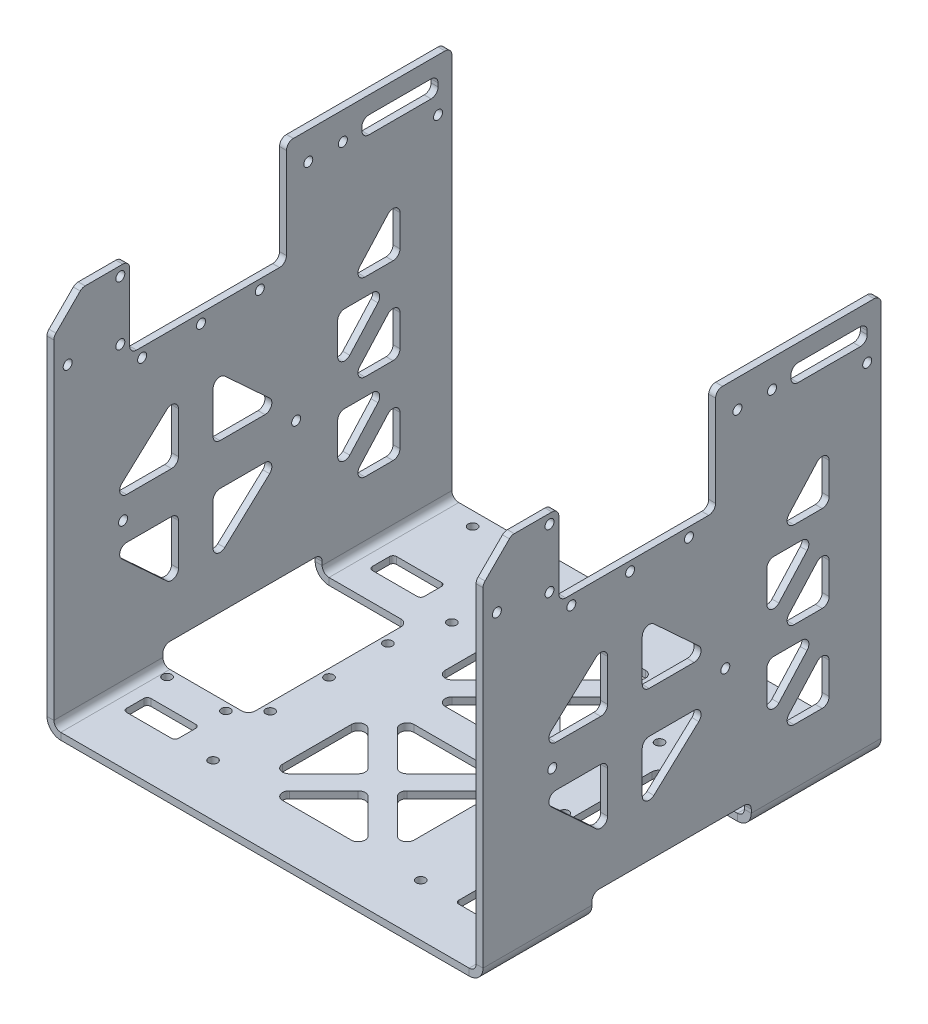
from build123d import *

# Parameters (mm, degrees)
BASE_FLANGE1_DEPTH       = 65
BASE_FLANGE1_DEPTH_BACK  = 50
CUT_EXTRUDE1_DEPTH       = 145.786049052
CUT_EXTRUDE1_DEPTH_BACK  = 145.786049052
SKETCH4_R                = 1.3
SKETCH4_R_2              = 5.623887655
CUT_EXTRUDE5_START       = -12.5
CUT_EXTRUDE5_DEPTH       = 46
CUT_EXTRUDE5_START_2     = -2
CUT_EXTRUDE5_2_OUTLINE_R = 1.3
CUT_EXTRUDE5_2_DEPTH     = 2
SKETCH26_W               = 26.75
SKETCH26_H               = 46
CUT_EXTRUDE7_DEPTH       = 7
CUT_EXTRUDE9_DEPTH       = 145.786049052
CUT_EXTRUDE9_DEPTH_BACK  = 145.786049052
SKETCH28_W               = 22
SKETCH28_H               = 5
SKETCH29_R               = 1.3
CUT_EXTRUDE10_DEPTH      = 10
CUT_EXTRUDE11_DEPTH      = 145.786049052
CUT_EXTRUDE11_DEPTH_BACK = 145.786049052
SKETCH30_R               = 1.3
CUT_EXTRUDE12_DEPTH      = 145.786049052
CUT_EXTRUDE12_DEPTH_BACK = 145.786049052
SKETCH31_R               = 1.3
CUT_EXTRUDE13_DEPTH      = 145.786049052
CUT_EXTRUDE13_DEPTH_BACK = 145.786049052
SKETCH32_R               = 1.3
SKETCH33_R               = 1.3
CUT_EXTRUDE14_DEPTH      = 5
SKETCH34_R               = 1.3
CUT_EXTRUDE15_DEPTH      = 10
CUT_EXTRUDE17_DEPTH      = 145.786049052
CUT_EXTRUDE17_DEPTH_BACK = 145.786049052
CUT_EXTRUDE18_DEPTH      = 145.786049052
CUT_EXTRUDE18_DEPTH_BACK = 145.786049052
SKETCH37_R               = 1.3
CUT_EXTRUDE19_DEPTH      = 145.786049052
CUT_EXTRUDE19_DEPTH_BACK = 145.786049052
SKETCH38_W               = 15.798506858
SKETCH38_H               = 6.8
SKETCH38_W_2             = 45.3
SKETCH38_H_2             = 30.3
FILLET1_R                = 2
CUT_EXTRUDE20_DEPTH      = 10
FILLET2_R                = 2
SKETCH40_W               = 15
SKETCH40_H               = 7
CUT_EXTRUDE21_DEPTH      = 10
FILLET4_R                = 1
CUT_EXTRUDE22_DEPTH      = 145.786049052
CUT_EXTRUDE22_DEPTH_BACK = 145.786049052
FILLET5_R                = 2
MIRROR3_START            = -63
MIRROR3_DEPTH            = 2
CUT_EXTRUDE23_DEPTH      = 145.786049052
CUT_EXTRUDE23_DEPTH_BACK = 145.786049052
FILLET6_R                = 2
MIRROR4_START            = -63
MIRROR4_DEPTH            = 2


# Read off the part's stored shape, not the designer's step: Cut-Extrude5, Mirror3, Mirror4
# Sheet-metal steps are written as plain solids
with BuildPart() as part:
    # Sketch1 → Base-Flange1 (new, two sides: drawn at the far end of the back side and taken through both)
    with BuildSketch(Plane.XY.offset(-BASE_FLANGE1_DEPTH_BACK)):
        with BuildLine():
            Line((-61, 113), (-61, 2))
            ThreePointArc((-61, 2), (-60.414213562, 0.585786438), (-59, 0))
            Line((-59, 0), (59, 0))
            ThreePointArc((59, 0), (60.414213562, 0.585786438), (61, 2))
            Line((61, 2), (61, 113))
            Line((61, 113), (63, 113))
            Line((63, 113), (63, 2))
            ThreePointArc((63, 2), (61.828427125, -0.828427125), (59, -2))
            Line((59, -2), (-59, -2))
            ThreePointArc((-59, -2), (-61.828427125, -0.828427125), (-63, 2))
            Line((-63, 2), (-63, 113))
            Line((-63, 113), (-61, 113))
        make_face()
    extrude(amount=BASE_FLANGE1_DEPTH + BASE_FLANGE1_DEPTH_BACK)

    # Sketch4 → Cut-Extrude1 (cut, two sides: drawn at the far end of the back side and taken through both)
    with BuildSketch(Plane(origin=(0, 0, 0), x_dir=(0, 0, -1), z_dir=(1, 0, 0)).offset(-CUT_EXTRUDE1_DEPTH_BACK)):
        with Locations((-22.5, 80)):
            Circle(SKETCH4_R)
        with Locations((-5.5, 80)):
            Circle(SKETCH4_R)
        with Locations((-39.5, 80)):
            Circle(SKETCH4_R)
        with Locations((-39.5, 110)):
            Circle(SKETCH4_R)
        with Locations((-22.5, 110)):
            Circle(SKETCH4_R)
        with Locations((-5.5, 110)):
            Circle(SKETCH4_R)
        with Locations((-10, 95)):
            Circle(SKETCH4_R_2)
        with Locations((-45.8, 103.5)):
            Circle(SKETCH4_R)
        with Locations((-45.8, 86.5)):
            Circle(SKETCH4_R)
    extrude(amount=CUT_EXTRUDE1_DEPTH + CUT_EXTRUDE1_DEPTH_BACK, mode=Mode.SUBTRACT)

    # Cut-Extrude5 outline → Cut-Extrude5 (cut)
    with BuildSketch(Plane.XY.offset(CUT_EXTRUDE5_START)):
        with BuildLine():
            Line((-59, -2), (-36.25, -2))
            Line((-36.25, -2), (-36.25, 0))
            Line((-36.25, 0), (-59, 0))
            ThreePointArc((-59, 0), (-59.740021111, 0.1419449), (-60.375, 0.547631245))
            Line((-60.375, 0.547631245), (-61.75, -0.90473751))
            ThreePointArc((-61.75, -0.90473751), (-60.480042223, -1.7161102), (-59, -2))
        make_face()
        with BuildLine():
            Line((36.25, 0), (36.25, -2))
            Line((36.25, -2), (59, -2))
            ThreePointArc((59, -2), (60.480042223, -1.7161102), (61.75, -0.90473751))
            Line((61.75, -0.90473751), (60.375, 0.547631245))
            ThreePointArc((60.375, 0.547631245), (59.740021111, 0.1419449), (59, 0))
            Line((59, 0), (36.25, 0))
        make_face()
    extrude(amount=CUT_EXTRUDE5_DEPTH, mode=Mode.SUBTRACT)

    # Cut-Extrude5 2 outline → Cut-Extrude5 2 (cut)
    with BuildSketch(Plane(origin=(0, 0, 0), x_dir=(1, 0, 0), z_dir=(0, 1, 0)).offset(CUT_EXTRUDE5_START_2)):
        with Locations((-57.5, -35.8)):
            Circle(CUT_EXTRUDE5_2_OUTLINE_R)
        with Locations((-40.5, -35.8)):
            Circle(CUT_EXTRUDE5_2_OUTLINE_R)
        with Locations((-34, -29.5)):
            Circle(CUT_EXTRUDE5_2_OUTLINE_R)
        with Locations((-34, -12.5)):
            Circle(CUT_EXTRUDE5_2_OUTLINE_R)
        with Locations((-34, 4.5)):
            Circle(CUT_EXTRUDE5_2_OUTLINE_R)
        with Locations((34, -12.5)):
            Circle(CUT_EXTRUDE5_2_OUTLINE_R)
        with Locations((34, 4.5)):
            Circle(CUT_EXTRUDE5_2_OUTLINE_R)
        with Locations((40.5, -35.8)):
            Circle(CUT_EXTRUDE5_2_OUTLINE_R)
        with Locations((57.5, -35.8)):
            Circle(CUT_EXTRUDE5_2_OUTLINE_R)
        with Locations((34, -29.5)):
            Circle(CUT_EXTRUDE5_2_OUTLINE_R)
    extrude(amount=CUT_EXTRUDE5_2_DEPTH, mode=Mode.SUBTRACT)

    # Sketch26 → Cut-Extrude7 (cut)
    with BuildSketch(Plane.XZ.offset(2)):
        with Locations((-49.625, 10.5)):
            Rectangle(SKETCH26_W, SKETCH26_H)
        with Locations((49.625, 10.5)):
            Rectangle(SKETCH26_W, SKETCH26_H)
    extrude(amount=-CUT_EXTRUDE7_DEPTH, mode=Mode.SUBTRACT)

    # Sketch28 → Cut-Extrude9 (cut, two sides: drawn at the far end of the back side and taken through both)
    with BuildSketch(Plane(origin=(0, 0, 0), x_dir=(0, 0, -1), z_dir=(1, 0, 0)).offset(-CUT_EXTRUDE9_DEPTH_BACK)):
        with Locations((35, 105.5)):
            Rectangle(SKETCH28_W, SKETCH28_H)
    extrude(amount=CUT_EXTRUDE9_DEPTH + CUT_EXTRUDE9_DEPTH_BACK, mode=Mode.SUBTRACT)

    # Sketch29 → Cut-Extrude10 (cut)
    with BuildSketch(Plane(origin=(0, 0, 0), x_dir=(1, 0, 0), z_dir=(0, 1, 0))):
        with Locations(Location((-31, 38, 0), (0, 0, 180))):
            Circle(SKETCH29_R)
        with Locations(Location((-31, 33, 0), (0, 0, 180))):
            Circle(SKETCH29_R)
        with Locations(Location((31, 33, 0), (0, 0, 180))):
            Circle(SKETCH29_R)
        with Locations(Location((31, 38, 0), (0, 0, 180))):
            Circle(SKETCH29_R)
    extrude(amount=-CUT_EXTRUDE10_DEPTH, mode=Mode.SUBTRACT)

    # Sketch30 → Cut-Extrude11 (cut, two sides: drawn at the far end of the back side and taken through both)
    with BuildSketch(Plane(origin=(0, 0, 0), x_dir=(0, 0, -1), z_dir=(1, 0, 0)).offset(-CUT_EXTRUDE11_DEPTH_BACK)):
        with Locations((-45, 42)):
            Circle(SKETCH30_R)
        with Locations((5, 42)):
            Circle(SKETCH30_R)
    extrude(amount=CUT_EXTRUDE11_DEPTH + CUT_EXTRUDE11_DEPTH_BACK, mode=Mode.SUBTRACT)

    # Sketch31 → Cut-Extrude12 (cut, two sides: drawn at the far end of the back side and taken through both)
    with BuildSketch(Plane(origin=(0, 0, 0), x_dir=(0, 0, -1), z_dir=(1, 0, 0)).offset(-CUT_EXTRUDE12_DEPTH_BACK)):
        with Locations((46, 98)):
            Circle(SKETCH31_R)
    extrude(amount=CUT_EXTRUDE12_DEPTH + CUT_EXTRUDE12_DEPTH_BACK, mode=Mode.SUBTRACT)

    # Sketch32 → Cut-Extrude13 (cut, two sides: drawn at the far end of the back side and taken through both)
    with BuildSketch(Plane(origin=(0, 0, 0), x_dir=(0, 0, -1), z_dir=(1, 0, 0)).offset(-CUT_EXTRUDE13_DEPTH_BACK)):
        with Locations((18.5, 105)):
            Circle(SKETCH32_R)
        with Locations((8.5, 105)):
            Circle(SKETCH32_R)
    extrude(amount=CUT_EXTRUDE13_DEPTH + CUT_EXTRUDE13_DEPTH_BACK, mode=Mode.SUBTRACT)

    # Sketch33 → Cut-Extrude14 (cut)
    with BuildSketch(Plane.XZ.offset(2)):
        with Locations((-51, -46)):
            Circle(SKETCH33_R)
        with Locations((51, -46)):
            Circle(SKETCH33_R)
    extrude(amount=-CUT_EXTRUDE14_DEPTH, mode=Mode.SUBTRACT)

    # Sketch34 → Cut-Extrude15 (cut)
    with BuildSketch(Plane(origin=(0, 0, 0), x_dir=(1, 0, 0), z_dir=(0, 1, 0))):
        with Locations(Location((-30, 19, 0), (0, 0, 180))):
            Circle(SKETCH34_R)
        with Locations(Location((30, 19, 0), (0, 0, 180))):
            Circle(SKETCH34_R)
        with Locations(Location((30, -50, 0), (0, 0, 180))):
            Circle(SKETCH34_R)
        with Locations(Location((-30, -50, 0), (0, 0, 180))):
            Circle(SKETCH34_R)
    extrude(amount=-CUT_EXTRUDE15_DEPTH, mode=Mode.SUBTRACT)

    # Sketch36 → Cut-Extrude17 (cut, two sides: drawn at the far end of the back side and taken through both)
    with BuildSketch(Plane(origin=(0, 0, 0), x_dir=(0, 0, -1), z_dir=(1, 0, 0)).offset(-CUT_EXTRUDE17_DEPTH_BACK)):
        Polygon((-65, 113), (-65, 98), (-50, 113), align=None)
    extrude(amount=CUT_EXTRUDE17_DEPTH + CUT_EXTRUDE17_DEPTH_BACK, mode=Mode.SUBTRACT)

    # Sketch37 → Cut-Extrude18 (cut, two sides: drawn at the far end of the back side and taken through both)
    with BuildSketch(Plane(origin=(0, 0, 0), x_dir=(0, 0, -1), z_dir=(1, 0, 0)).offset(-CUT_EXTRUDE18_DEPTH_BACK)):
        with Locations((-61, 89)):
            Circle(SKETCH37_R)
    extrude(amount=CUT_EXTRUDE18_DEPTH + CUT_EXTRUDE18_DEPTH_BACK, mode=Mode.SUBTRACT)

    # Sketch38 → Cut-Extrude19 (cut, two sides: drawn at the far end of the back side and taken through both)
    with BuildSketch(Plane(origin=(0, 0, 0), x_dir=(0, 0, -1), z_dir=(1, 0, 0)).offset(-CUT_EXTRUDE19_DEPTH_BACK)):
        with Locations((-50.999253429, 109.6)):
            Rectangle(SKETCH38_W, SKETCH38_H)
        with Locations((-20.45, 97.85)):
            Rectangle(SKETCH38_W_2, SKETCH38_H_2)
    extrude(amount=CUT_EXTRUDE19_DEPTH + CUT_EXTRUDE19_DEPTH_BACK, mode=Mode.SUBTRACT)

    # Fillet1
    fillet1_edges = [part.edges().sort_by_distance(p)[0] for p in [
        (-36.25, -1, 33.5),
        (-36.25, -1, -12.5),
        (36.25, -1, 33.5),
        (36.25, -1, -12.5),
        (-62, 113, -50),
        (-62, 5, -12.5),
        (-62, 5, 33.5),
        (62, 113, -50),
        (62, 5, 33.5),
        (62, 5, -12.5),
        (62, 108, -46),
        (62, 103, -46),
        (62, 103, -24),
        (62, 108, -24),
        (-62, 108, -46),
        (-62, 103, -46),
        (-62, 103, -24),
        (-62, 108, -24),
        (-62, 98, 65),
        (62, 98, 65),
        (62, 113, -2.2),
        (62, 82.7, -2.2),
        (62, 82.7, 43.1),
        (62, 106.2, 43.1),
        (62, 106.2, 56.8),
        (-62, 82.7, 43.1),
        (-62, 82.7, -2.2),
        (-62, 113, -2.2),
        (-62, 106.2, 56.8),
        (-62, 106.2, 43.1),
    ]]
    fillet(fillet1_edges, radius=FILLET1_R)

    # Sketch39 → Cut-Extrude20 (cut)
    with BuildSketch(Plane(origin=(0, 0, 0), x_dir=(1, 0, 0), z_dir=(0, 1, 0))):
        Polygon((-4.242640687, 16), (-19, 30.757359313), (-19, 1.242640687), align=None)
        Polygon((14.757359313, -3), (0, 11.757359313), (-14.757359313, -3), align=None)
        Polygon((19, 30.757359313), (4.242640687, 16), (19, 1.242640687), align=None)
        Polygon((14.757359313, 35), (-14.757359313, 35), (0, 20.242640687), align=None)
        Polygon((14.757359313, -12), (-14.757359313, -12), (0, -26.757359313), align=None)
        Polygon((-4.242640687, -31), (-19, -16.242640687), (-19, -45.757359313), align=None)
        Polygon((14.757359313, -50), (0, -35.242640687), (-14.757359313, -50), align=None)
        Polygon((19, -45.757359313), (19, -16.242640687), (4.242640687, -31), align=None)
    extrude(amount=-CUT_EXTRUDE20_DEPTH, mode=Mode.SUBTRACT)

    # Fillet2
    fillet2_edges = [part.edges().sort_by_distance(p)[0] for p in [
        (-14.757359313, -1, 12),
        (14.757359313, -1, 12),
        (0, -1, 26.757359313),
        (0, -1, -20.242640687),
        (-14.757359313, -1, -35),
        (14.757359313, -1, -35),
        (0, -1, -11.757359313),
        (14.757359313, -1, 3),
        (-14.757359313, -1, 3),
        (19, -1, -30.757359313),
        (19, -1, -1.242640687),
        (4.242640687, -1, -16),
        (4.242640687, -1, 31),
        (19, -1, 16.242640687),
        (19, -1, 45.757359313),
        (-4.242640687, -1, 31),
        (-19, -1, 45.757359313),
        (-19, -1, 16.242640687),
        (14.757359313, -1, 50),
        (-14.757359313, -1, 50),
        (0, -1, 35.242640687),
        (-19, -1, -1.242640687),
        (-19, -1, -30.757359313),
        (-4.242640687, -1, -16),
    ]]
    fillet(fillet2_edges, radius=FILLET2_R)

    # Sketch40 → Cut-Extrude21 (cut)
    with BuildSketch(Plane(origin=(0, 0, 0), x_dir=(1, 0, 0), z_dir=(0, 1, 0))):
        with Locations((-48, 24)):
            Rectangle(SKETCH40_W, SKETCH40_H)
        with Locations((-48, -47)):
            Rectangle(SKETCH40_W, SKETCH40_H)
        with Locations((48, -47)):
            Rectangle(SKETCH40_W, SKETCH40_H)
        with Locations((48, 24)):
            Rectangle(SKETCH40_W, SKETCH40_H)
    extrude(amount=-CUT_EXTRUDE21_DEPTH, mode=Mode.SUBTRACT)

    # Fillet4
    fillet4_edges = [part.edges().sort_by_distance(p)[0] for p in [
        (55.5, -1, -27.5),
        (55.5, -1, -20.5),
        (40.5, -1, -20.5),
        (40.5, -1, -27.5),
        (55.5, -1, 43.5),
        (55.5, -1, 50.5),
        (40.5, -1, 50.5),
        (40.5, -1, 43.5),
        (-40.5, -1, 43.5),
        (-40.5, -1, 50.5),
        (-55.5, -1, 50.5),
        (-55.5, -1, 43.5),
        (-40.5, -1, -27.5),
        (-40.5, -1, -20.5),
        (-55.5, -1, -20.5),
        (-55.5, -1, -27.5),
    ]]
    fillet(fillet4_edges, radius=FILLET4_R)

    # Sketch41 → Cut-Extrude22 (cut, two sides: drawn at the far end of the back side and taken through both)
    with BuildSketch(Plane(origin=(0, 0, 0), x_dir=(0, 0, -1), z_dir=(1, 0, 0)).offset(-CUT_EXTRUDE22_DEPTH_BACK)):
        Polygon((35, 68), (35, 84.262882209), (20.363406012, 68), align=None)
        Polygon((31.636593988, 63), (17, 63), (17, 46.737117791), align=None)
        Polygon((35, 43), (35, 59.262882209), (20.363406012, 43), align=None)
        Polygon((31.636593988, 38), (17, 38), (17, 21.737117791), align=None)
        Polygon((35, 18), (35, 34.262882209), (20.363406012, 18), align=None)
    extrude(amount=CUT_EXTRUDE22_DEPTH + CUT_EXTRUDE22_DEPTH_BACK, mode=Mode.SUBTRACT)

    # Fillet5
    fillet5_edges = [part.edges().sort_by_distance(p)[0] for p in [
        (62, 84.262882209, -35),
        (62, 68, -35),
        (62, 68, -20.363406012),
        (62, 59.262882209, -35),
        (62, 43, -35),
        (62, 43, -20.363406012),
        (62, 46.737117791, -17),
        (62, 63, -17),
        (62, 63, -31.636593988),
        (62, 34.262882209, -35),
        (62, 18, -35),
        (62, 18, -20.363406012),
        (62, 38, -31.636593988),
        (62, 21.737117791, -17),
        (62, 38, -17),
    ]]
    fillet(fillet5_edges, radius=FILLET5_R)

    # Mirror3 outline → Mirror3 (add)
    with BuildSketch(Plane.YZ.offset(MIRROR3_START)):
        with BuildLine():
            Line((46.737117791, -17), (50.611104783, -20.486588292))
            ThreePointArc((50.611104783, -20.486588292), (50.081793422, -18.283472465), (51.949034246, -17))
            Line((51.949034246, -17), (46.737117791, -17))
        make_face()
        with BuildLine():
            ThreePointArc((63, -27.145869179), (61.81367717, -28.972869306), (59.662070537, -28.632457471))
            Line((59.662070537, -28.632457471), (63, -31.636593988))
            Line((63, -31.636593988), (63, -27.145869179))
        make_face()
        with BuildLine():
            Line((63, -17), (61, -17))
            ThreePointArc((61, -17), (62.414213562, -17.585786438), (63, -19))
            Line((63, -19), (63, -17))
        make_face()
        with BuildLine():
            ThreePointArc((25.611104783, -20.486588292), (25.081793422, -18.283472465), (26.949034246, -17))
            Line((26.949034246, -17), (21.737117791, -17))
            Line((21.737117791, -17), (25.611104783, -20.486588292))
        make_face()
        with BuildLine():
            Line((38, -17), (36, -17))
            ThreePointArc((36, -17), (37.414213562, -17.585786438), (38, -19))
            Line((38, -19), (38, -17))
        make_face()
        with BuildLine():
            ThreePointArc((38, -27.145869179), (36.81367717, -28.972869306), (34.662070537, -28.632457471))
            Line((34.662070537, -28.632457471), (38, -31.636593988))
            Line((38, -31.636593988), (38, -27.145869179))
        make_face()
        with BuildLine():
            ThreePointArc((20, -35), (18.585786438, -34.414213562), (18, -33))
            Line((18, -33), (18, -35))
            Line((18, -35), (20, -35))
        make_face()
        with BuildLine():
            Line((18, -20.363406012), (18, -24.854130821))
            ThreePointArc((18, -24.854130821), (19.18632283, -23.027130694), (21.337929463, -23.367542529))
            Line((21.337929463, -23.367542529), (18, -20.363406012))
        make_face()
        with BuildLine():
            ThreePointArc((30.388895217, -31.513411708), (30.918206578, -33.716527535), (29.050965754, -35))
            Line((29.050965754, -35), (34.262882209, -35))
            Line((34.262882209, -35), (30.388895217, -31.513411708))
        make_face()
        with BuildLine():
            ThreePointArc((45, -35), (43.585786438, -34.414213562), (43, -33))
            Line((43, -33), (43, -35))
            Line((43, -35), (45, -35))
        make_face()
        with BuildLine():
            Line((43, -20.363406012), (43, -24.854130821))
            ThreePointArc((43, -24.854130821), (44.18632283, -23.027130694), (46.337929463, -23.367542529))
            Line((46.337929463, -23.367542529), (43, -20.363406012))
        make_face()
        with BuildLine():
            ThreePointArc((55.388895217, -31.513411708), (55.918206578, -33.716527535), (54.050965754, -35))
            Line((54.050965754, -35), (59.262882209, -35))
            Line((59.262882209, -35), (55.388895217, -31.513411708))
        make_face()
        with BuildLine():
            ThreePointArc((70, -35), (68.585786438, -34.414213562), (68, -33))
            Line((68, -33), (68, -35))
            Line((68, -35), (70, -35))
        make_face()
        with BuildLine():
            Line((68, -20.363406012), (68, -24.854130821))
            ThreePointArc((68, -24.854130821), (69.18632283, -23.027130694), (71.337929463, -23.367542529))
            Line((71.337929463, -23.367542529), (68, -20.363406012))
        make_face()
        with BuildLine():
            ThreePointArc((80.388895217, -31.513411708), (80.918206578, -33.716527535), (79.050965754, -35))
            Line((79.050965754, -35), (84.262882209, -35))
            Line((84.262882209, -35), (80.388895217, -31.513411708))
        make_face()
    extrude(amount=MIRROR3_DEPTH)

    # Sketch42 → Cut-Extrude23 (cut, two sides: drawn at the far end of the back side and taken through both)
    with BuildSketch(Plane(origin=(0, 0, 0), x_dir=(0, 0, -1), z_dir=(1, 0, 0)).offset(-CUT_EXTRUDE23_DEPTH_BACK)):
        Polygon((1.102731329, 48), (-19, 66.556367381), (-19, 48), align=None)
        Polygon((-29, 17.443632619), (-29, 36), (-49.102731329, 36), align=None)
        Polygon((-29, 48), (-29, 66.556367381), (-49.102731329, 48), align=None)
        Polygon((1.102731329, 36), (-19, 36), (-19, 17.443632619), align=None)
    extrude(amount=CUT_EXTRUDE23_DEPTH + CUT_EXTRUDE23_DEPTH_BACK, mode=Mode.SUBTRACT)

    # Fillet6
    fillet6_edges = [part.edges().sort_by_distance(p)[0] for p in [
        (62, 17.443632619, 19),
        (62, 36, 19),
        (62, 36, -1.102731329),
        (62, 66.556367381, 29),
        (62, 48, 29),
        (62, 48, 49.102731329),
        (62, 36, 49.102731329),
        (62, 36, 29),
        (62, 17.443632619, 29),
        (62, 66.556367381, 19),
        (62, 48, -1.102731329),
        (62, 48, 19),
    ]]
    fillet(fillet6_edges, radius=FILLET6_R)

    # Mirror4 outline → Mirror4 (add)
    with BuildSketch(Plane.YZ.offset(MIRROR4_START)):
        with BuildLine():
            Line((36, 29), (36, 31))
            ThreePointArc((36, 31), (35.414213562, 29.585786438), (34, 29))
            Line((34, 29), (36, 29))
        make_face()
        with BuildLine():
            ThreePointArc((32.530393111, 45.343990532), (34.728280928, 45.850118408), (36, 43.987430327))
            Line((36, 43.987430327), (36, 49.102731329))
            Line((36, 49.102731329), (32.530393111, 45.343990532))
        make_face()
        with BuildLine():
            Line((17.443632619, 29), (22.011602775, 29))
            ThreePointArc((22.011602775, 29), (20.179511018, 30.197853009), (20.541995886, 32.356560205))
            Line((20.541995886, 32.356560205), (17.443632619, 29))
        make_face()
        with BuildLine():
            Line((36, 19), (34, 19))
            ThreePointArc((34, 19), (35.414213562, 18.414213562), (36, 17))
            Line((36, 17), (36, 19))
        make_face()
        with BuildLine():
            ThreePointArc((20.541995886, 15.643439795), (20.179511018, 17.802146991), (22.011602775, 19))
            Line((22.011602775, 19), (17.443632619, 19))
            Line((17.443632619, 19), (20.541995886, 15.643439795))
        make_face()
        with BuildLine():
            Line((36, -1.102731329), (36, 4.012569673))
            ThreePointArc((36, 4.012569673), (34.728280928, 2.149881592), (32.530393111, 2.656009468))
            Line((32.530393111, 2.656009468), (36, -1.102731329))
        make_face()
        with BuildLine():
            ThreePointArc((50, 29), (48.585786438, 29.585786438), (48, 31))
            Line((48, 31), (48, 29))
            Line((48, 29), (50, 29))
        make_face()
        with BuildLine():
            Line((48, 49.102731329), (48, 43.987430327))
            ThreePointArc((48, 43.987430327), (49.271719072, 45.850118408), (51.469606889, 45.343990532))
            Line((51.469606889, 45.343990532), (48, 49.102731329))
        make_face()
        with BuildLine():
            ThreePointArc((63.458004114, 32.356560205), (63.820488982, 30.197853009), (61.988397225, 29))
            Line((61.988397225, 29), (66.556367381, 29))
            Line((66.556367381, 29), (63.458004114, 32.356560205))
        make_face()
        with BuildLine():
            ThreePointArc((51.469606889, 2.656009468), (49.271719072, 2.149881592), (48, 4.012569673))
            Line((48, 4.012569673), (48, -1.102731329))
            Line((48, -1.102731329), (51.469606889, 2.656009468))
        make_face()
        with BuildLine():
            Line((48, 19), (48, 17))
            ThreePointArc((48, 17), (48.585786438, 18.414213562), (50, 19))
            Line((50, 19), (48, 19))
        make_face()
        with BuildLine():
            ThreePointArc((61.988397225, 19), (63.820488982, 17.802146991), (63.458004114, 15.643439795))
            Line((63.458004114, 15.643439795), (66.556367381, 19))
            Line((66.556367381, 19), (61.988397225, 19))
        make_face()
    extrude(amount=MIRROR4_DEPTH)


solid = part.part
